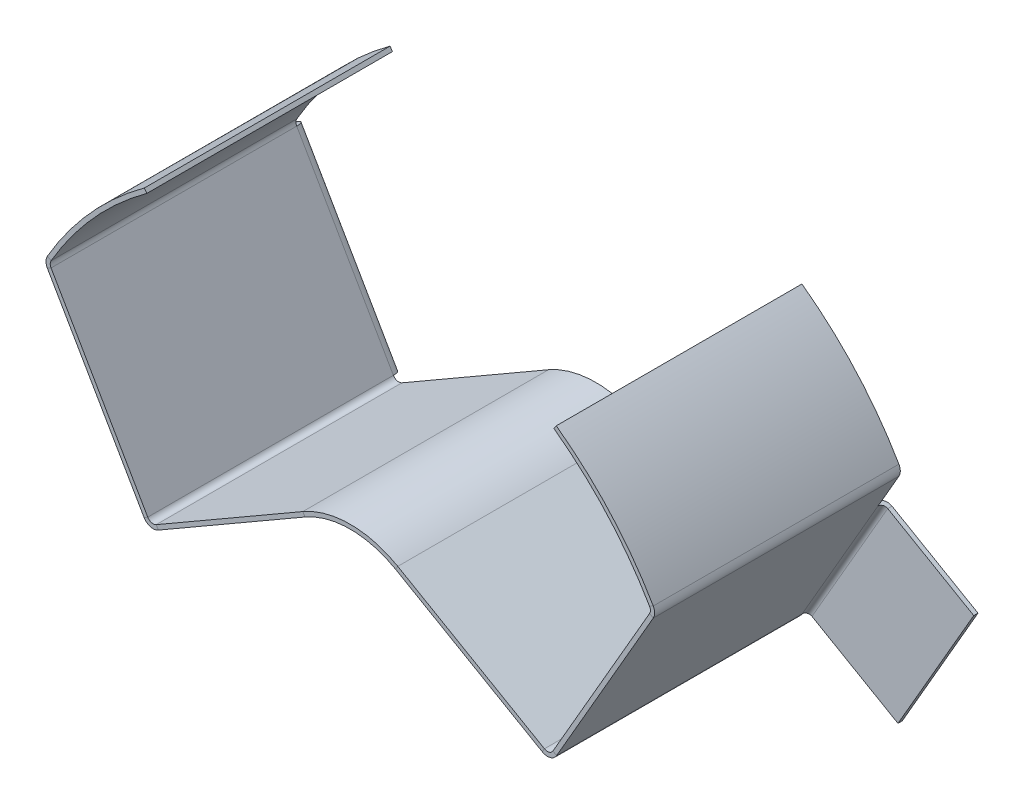
from build123d import *

# Parameters (mm, degrees)
BASE_FLANGE1_DEPTH      = 46.19
BASE_FLANGE1_DEPTH_BACK = 0.8128
EDGE_FLANGE1_DEPTH      = 37
EDGE_FLANGE1_START      = 0.8128
EDGE_FLANGE1_FLAT_DEPTH = 0.8128
EDGE_FLANGE1_BEND_DEPTH = 29


# Sheet-metal steps are written as plain solids
with BuildPart() as part:
    # Sketch1 → Base-Flange1 (new, two sides: drawn at the far end of the back side and taken through both)
    with BuildSketch(Plane.XY.offset(-BASE_FLANGE1_DEPTH_BACK)):
        with BuildLine():
            ThreePointArc((145.409019443, 88.185), (155.762419921, 78.86409034), (163.964489977, 67.603614987))
            ThreePointArc((163.964489977, 67.603614987), (164.234222289, 66.60231267), (163.96627389, 65.600531503))
            Line((163.96627389, 65.600531503), (145.46627389, 33.557591563))
            ThreePointArc((145.46627389, 33.557591563), (144.251861173, 32.625739911), (142.734223083, 32.825540756))
            Line((142.734223083, 32.825540756), (114.675, 49.025540756))
            ThreePointArc((114.675, 49.025540756), (106, 51.35), (97.325, 49.025540756))
            Line((97.325, 49.025540756), (69.265776917, 32.825540756))
            ThreePointArc((69.265776917, 32.825540756), (67.748138827, 32.625739911), (66.53372611, 33.557591563))
            Line((66.53372611, 33.557591563), (48.03372611, 65.600531503))
            ThreePointArc((48.03372611, 65.600531503), (47.76577771, 66.60231267), (48.035510023, 67.603614987))
            ThreePointArc((48.035510023, 67.603614987), (56.237580079, 78.86409034), (66.590980557, 88.185))
            Line((66.590980557, 88.185), (67.069060372, 87.52766939))
            ThreePointArc((67.069060372, 87.52766939), (56.841259359, 78.319833814), (48.738690489, 67.195961859))
            ThreePointArc((48.738690489, 67.195961859), (48.578577388, 66.601588804), (48.737631558, 66.006931503))
            Line((48.737631558, 66.006931503), (67.237631558, 33.963991563))
            ThreePointArc((67.237631558, 33.963991563), (67.958506947, 33.410844422), (68.859376917, 33.529446204))
            Line((68.859376917, 33.529446204), (96.9186, 49.729446204))
            ThreePointArc((96.9186, 49.729446204), (106, 52.1628), (115.0814, 49.729446204))
            Line((115.0814, 49.729446204), (143.140623083, 33.529446204))
            ThreePointArc((143.140623083, 33.529446204), (144.041493053, 33.410844422), (144.762368442, 33.963991563))
            Line((144.762368442, 33.963991563), (163.262368442, 66.006931503))
            ThreePointArc((163.262368442, 66.006931503), (163.421422612, 66.601588804), (163.261309511, 67.195961859))
            ThreePointArc((163.261309511, 67.195961859), (155.158740641, 78.319833814), (144.930939628, 87.52766939))
            Line((144.930939628, 87.52766939), (145.409019443, 88.185))
        make_face()
    extrude(amount=BASE_FLANGE1_DEPTH + BASE_FLANGE1_DEPTH_BACK)

    # Edge-Flange1 bend section (across the edge) → Edge-Flange1 (add)
    with BuildSketch(Plane(origin=(48.03372611, 65.600531503, -1.8128), x_dir=(0, 0, 1), z_dir=(0.5000000000000168, -0.866025403784429, 0))):
        with BuildLine():
            Line((-0.8128, 1), (0, 1))
            ThreePointArc((0, 1), (0.292893219, 0.292893219), (1, 0))
            Line((1, 0), (1, -0.8128))
            ThreePointArc((1, -0.8128), (-0.281843173, -0.281843173), (-0.8128, 1))
        make_face()
    extrude(amount=EDGE_FLANGE1_DEPTH)

    # Edge-Flange1 profile (on flange) → Edge-Flange1 flat (add)
    with BuildSketch(Plane(origin=(64.431157974, 37.199346401, -1.8128), x_dir=(0.5000000000000168, -0.866025403784429, 0), z_dir=(0, 0, -1)).offset(EDGE_FLANGE1_START)):
        Polygon((-32.794863729, 1), (4.205136271, 1), (4.205136271, 27.36195996), (-32.794863729, 6), align=None)
    extrude(amount=-EDGE_FLANGE1_FLAT_DEPTH)

    # Edge-Flange1 section (across the edge) → Edge-Flange1 bend (add)
    with BuildSketch(Plane(origin=(145.46627389, 33.557591563, -1.8128), x_dir=(0, 0, 1), z_dir=(0.4999999999999994, 0.866025403784439, 0))):
        with BuildLine():
            Line((-0.8128, 1), (-0.8128, 20))
            Line((-0.8128, 20), (0, 20))
            Line((0, 20), (0, 1))
            ThreePointArc((0, 1), (0.292893219, 0.292893219), (1, 0))
            Line((1, 0), (1, -0.8128))
            ThreePointArc((1, -0.8128), (-0.281843173, -0.281843173), (-0.8128, 1))
        make_face()
    extrude(amount=EDGE_FLANGE1_BEND_DEPTH)


solid = part.part
